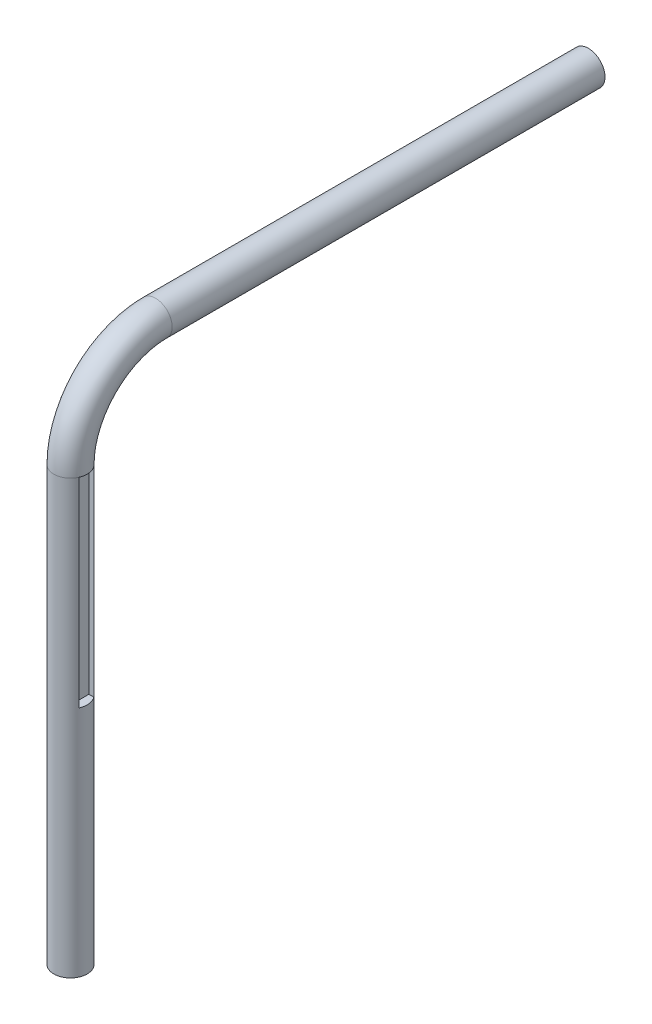
from build123d import *

# Parameters (mm, degrees)
SKETCH3_R           = 12.7
SKETCH4_R           = 12.7
BOSS_EXTRUDE3_DEPTH = 330.2
SKETCH5_R           = 12.7
BOSS_EXTRUDE4_DEPTH = 330.2
SKETCH7_W           = 12.7
SKETCH7_H           = 152.4
CUT_EXTRUDE2_DEPTH  = 6.35


with BuildPart() as part:
    # Sweep1: sweep along a path in Sketch2
    with BuildLine(Plane(origin=(0, 0, 0), x_dir=(0, 0, -1), z_dir=(1, 0, 0))) as sweep1_path:
        ThreePointArc((-64.833774642, 0), (-45.844401699, 45.844401699), (0, 64.833774642))
    # Sketch3 → Sweep1 (sweep)
    with BuildSketch(Plane(origin=(0, 0, 0), x_dir=(1, 0, 0), z_dir=(0, 1, 0))):
        with Locations((0, -64.833774642)):
            Circle(SKETCH3_R)
    sweep(path=sweep1_path.line)

    # Sketch4 → Boss-Extrude3 (add)
    with BuildSketch(Plane(origin=(0, 0, 0), x_dir=(-1, 0, 0), z_dir=(0, -1, 0))):
        with Locations((0, -64.833774642)):
            Circle(SKETCH4_R)
    extrude(amount=BOSS_EXTRUDE3_DEPTH)

    # Sketch5 → Boss-Extrude4 (add)
    with BuildSketch(Plane(origin=(0, 0, 0), x_dir=(-1, 0, 0), z_dir=(0, 0, -1))):
        with Locations((0, 64.833774642)):
            Circle(SKETCH5_R)
    extrude(amount=BOSS_EXTRUDE4_DEPTH)

    # Sketch7 → Cut-Extrude2 (cut)
    with BuildSketch(Plane(origin=(12.7, 0, 0), x_dir=(0, 0, -1), z_dir=(1, 0, 0))):
        with Locations((-63.5, -76.2)):
            Rectangle(SKETCH7_W, SKETCH7_H)
    extrude(amount=-CUT_EXTRUDE2_DEPTH, mode=Mode.SUBTRACT)


solid = part.part
